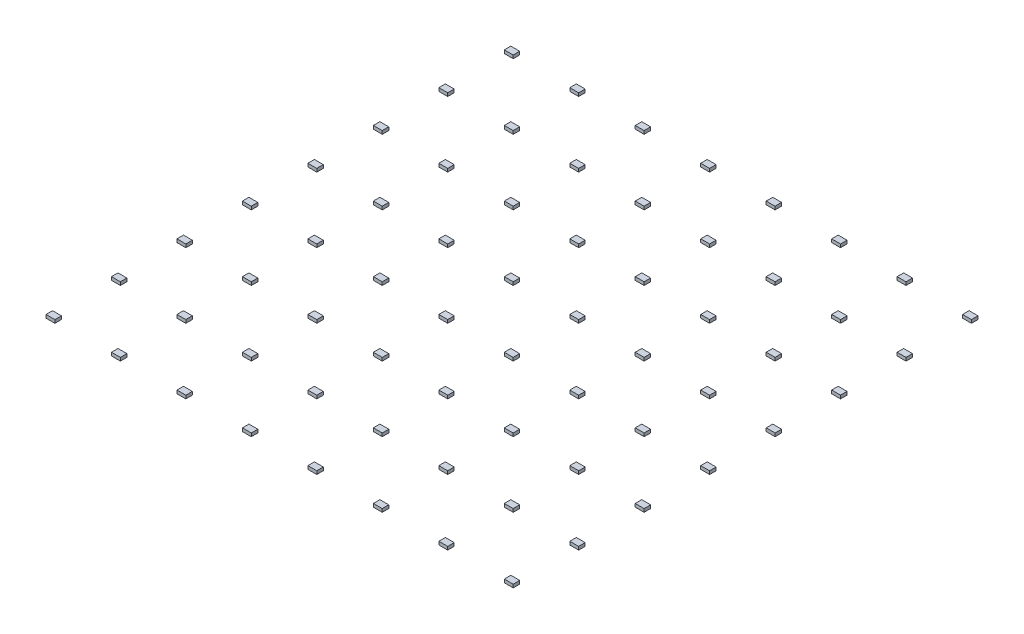
from build123d import *

# Parameters (mm, degrees)
SKETCH1_W                = 200
SKETCH1_H                = 200
BOSS_EXTRUDE1_DEPTH      = 3
SKETCH2_W                = 24.5625
SKETCH2_H                = 24.5625
CUT_EXTRUDE1_DEPTH       = 0.25
SKETCH4_W                = 4.4
SKETCH4_H                = 3.5
SKETCH4_W_2              = 3.9
SKETCH4_H_2              = 3
SKETCH4_W_3              = 1.95
SKETCH4_H_3              = 1.5
CUT_EXTRUDE2_DEPTH       = 1.5
SKETCH7_W                = 4.4
SKETCH7_H                = 3.5
SKETCH7_W_2              = 3.4
SKETCH7_H_2              = 2.5
CUT_EXTRUDE4_DEPTH       = 1.25
SKETCH8_W                = 219.159240905
SKETCH8_H                = 226.00633715
CUT_EXTRUDE5_DEPTH       = 1.5
CUT_EXTRUDE6_START       = -1.5
CUT_EXTRUDE6_OUTLINE_W   = 200
CUT_EXTRUDE6_OUTLINE_H   = 200
CUT_EXTRUDE6_OUTLINE_W_2 = 4.4
CUT_EXTRUDE6_OUTLINE_H_2 = 3.5
CUT_EXTRUDE6_DEPTH       = 1.5
CUT_EXTRUDE6_START_2     = -0.25
CUT_EXTRUDE6_2_OUTLINE_W = 4.4
CUT_EXTRUDE6_2_OUTLINE_H = 3.5
CUT_EXTRUDE6_2_DEPTH     = 0.25


with BuildPart() as part:
    # Sketch1 → Boss-Extrude1 (new body)
    with BuildSketch(Plane(origin=(0, 0, 0), x_dir=(1, 0, 0), z_dir=(0, 1, 0))):
        with Locations((100, 100)):
            Rectangle(SKETCH1_W, SKETCH1_H)
    extrude(amount=BOSS_EXTRUDE1_DEPTH)

    # Sketch2 → Cut-Extrude1 (cut)
    with BuildSketch(Plane(origin=(0, 3, 0), x_dir=(1, 0, 0), z_dir=(0, 1, 0))):
        Polygon((150.375, 24.5625), (174.9375, 24.5625), (174.9375, 0), (175.4375, 0), (175.4375, 24.5625), (200, 24.5625), (200, 25.0625), (175.4375, 25.0625), (175.4375, 49.625), (200, 49.625), (200, 50.125), (175.4375, 50.125), (175.4375, 74.6875), (200, 74.6875), (200, 75.1875), (175.4375, 75.1875), (175.4375, 99.75), (200, 99.75), (200, 100.25), (175.4375, 100.25), (175.4375, 124.8125), (200, 124.8125), (200, 125.3125), (175.4375, 125.3125), (175.4375, 149.875), (200, 149.875), (200, 150.375), (175.4375, 150.375), (175.4375, 174.9375), (200, 174.9375), (200, 175.4375), (175.4375, 175.4375), (175.4375, 200), (174.9375, 200), (174.9375, 175.4375), (150.375, 175.4375), (150.375, 200), (149.875, 200), (149.875, 175.4375), (125.3125, 175.4375), (125.3125, 200), (124.8125, 200), (124.8125, 175.4375), (100.25, 175.4375), (100.25, 200), (99.75, 200), (99.75, 175.4375), (75.1875, 175.4375), (75.1875, 200), (74.6875, 200), (74.6875, 175.4375), (50.125, 175.4375), (50.125, 200), (49.625, 200), (49.625, 175.4375), (25.0625, 175.4375), (25.0625, 200), (24.5625, 200), (24.5625, 175.4375), (0, 175.4375), (0, 174.9375), (24.5625, 174.9375), (24.5625, 150.375), (0, 150.375), (0, 149.875), (24.5625, 149.875), (24.5625, 125.3125), (0, 125.3125), (0, 124.8125), (24.5625, 124.8125), (24.5625, 100.25), (0, 100.25), (0, 99.75), (24.5625, 99.75), (24.5625, 75.1875), (0, 75.1875), (0, 74.6875), (24.5625, 74.6875), (24.5625, 50.125), (0, 50.125), (0, 49.625), (24.5625, 49.625), (24.5625, 25.0625), (0, 25.0625), (0, 24.5625), (24.5625, 24.5625), (24.5625, 0), (25.0625, 0), (25.0625, 24.5625), (49.625, 24.5625), (49.625, 0), (50.125, 0), (50.125, 24.5625), (74.6875, 24.5625), (74.6875, 0), (75.1875, 0), (75.1875, 24.5625), (99.75, 24.5625), (99.75, 0), (100.25, 0), (100.25, 24.5625), (124.8125, 24.5625), (124.8125, 0), (125.3125, 0), (125.3125, 24.5625), (149.875, 24.5625), (149.875, 0), (150.375, 0), align=None)
        with Locations((37.34375, 37.34375)):
            Rectangle(SKETCH2_W, SKETCH2_H, mode=Mode.SUBTRACT)
        with Locations((62.40625, 37.34375)):
            Rectangle(SKETCH2_W, SKETCH2_H, mode=Mode.SUBTRACT)
        with Locations((37.34375, 62.40625)):
            Rectangle(SKETCH2_W, SKETCH2_H, mode=Mode.SUBTRACT)
        with Locations((62.40625, 62.40625)):
            Rectangle(SKETCH2_W, SKETCH2_H, mode=Mode.SUBTRACT)
        with Locations((87.46875, 37.34375)):
            Rectangle(SKETCH2_W, SKETCH2_H, mode=Mode.SUBTRACT)
        with Locations((87.46875, 62.40625)):
            Rectangle(SKETCH2_W, SKETCH2_H, mode=Mode.SUBTRACT)
        with Locations((37.34375, 87.46875)):
            Rectangle(SKETCH2_W, SKETCH2_H, mode=Mode.SUBTRACT)
        with Locations((62.40625, 87.46875)):
            Rectangle(SKETCH2_W, SKETCH2_H, mode=Mode.SUBTRACT)
        with Locations((87.46875, 87.46875)):
            Rectangle(SKETCH2_W, SKETCH2_H, mode=Mode.SUBTRACT)
        with Locations((112.53125, 37.34375)):
            Rectangle(SKETCH2_W, SKETCH2_H, mode=Mode.SUBTRACT)
        with Locations((112.53125, 62.40625)):
            Rectangle(SKETCH2_W, SKETCH2_H, mode=Mode.SUBTRACT)
        with Locations((137.59375, 37.34375)):
            Rectangle(SKETCH2_W, SKETCH2_H, mode=Mode.SUBTRACT)
        with Locations((162.65625, 37.34375)):
            Rectangle(SKETCH2_W, SKETCH2_H, mode=Mode.SUBTRACT)
        with Locations((137.59375, 62.40625)):
            Rectangle(SKETCH2_W, SKETCH2_H, mode=Mode.SUBTRACT)
        with Locations((162.65625, 62.40625)):
            Rectangle(SKETCH2_W, SKETCH2_H, mode=Mode.SUBTRACT)
        with Locations((112.53125, 87.46875)):
            Rectangle(SKETCH2_W, SKETCH2_H, mode=Mode.SUBTRACT)
        with Locations((137.59375, 87.46875)):
            Rectangle(SKETCH2_W, SKETCH2_H, mode=Mode.SUBTRACT)
        with Locations((162.65625, 87.46875)):
            Rectangle(SKETCH2_W, SKETCH2_H, mode=Mode.SUBTRACT)
        with Locations((37.34375, 112.53125)):
            Rectangle(SKETCH2_W, SKETCH2_H, mode=Mode.SUBTRACT)
        with Locations((62.40625, 112.53125)):
            Rectangle(SKETCH2_W, SKETCH2_H, mode=Mode.SUBTRACT)
        with Locations((87.46875, 112.53125)):
            Rectangle(SKETCH2_W, SKETCH2_H, mode=Mode.SUBTRACT)
        with Locations((37.34375, 137.59375)):
            Rectangle(SKETCH2_W, SKETCH2_H, mode=Mode.SUBTRACT)
        with Locations((62.40625, 137.59375)):
            Rectangle(SKETCH2_W, SKETCH2_H, mode=Mode.SUBTRACT)
        with Locations((37.34375, 162.65625)):
            Rectangle(SKETCH2_W, SKETCH2_H, mode=Mode.SUBTRACT)
        with Locations((62.40625, 162.65625)):
            Rectangle(SKETCH2_W, SKETCH2_H, mode=Mode.SUBTRACT)
        with Locations((87.46875, 137.59375)):
            Rectangle(SKETCH2_W, SKETCH2_H, mode=Mode.SUBTRACT)
        with Locations((87.46875, 162.65625)):
            Rectangle(SKETCH2_W, SKETCH2_H, mode=Mode.SUBTRACT)
        with Locations((112.53125, 112.53125)):
            Rectangle(SKETCH2_W, SKETCH2_H, mode=Mode.SUBTRACT)
        with Locations((137.59375, 112.53125)):
            Rectangle(SKETCH2_W, SKETCH2_H, mode=Mode.SUBTRACT)
        with Locations((162.65625, 112.53125)):
            Rectangle(SKETCH2_W, SKETCH2_H, mode=Mode.SUBTRACT)
        with Locations((112.53125, 137.59375)):
            Rectangle(SKETCH2_W, SKETCH2_H, mode=Mode.SUBTRACT)
        with Locations((112.53125, 162.65625)):
            Rectangle(SKETCH2_W, SKETCH2_H, mode=Mode.SUBTRACT)
        with Locations((137.59375, 137.59375)):
            Rectangle(SKETCH2_W, SKETCH2_H, mode=Mode.SUBTRACT)
        with Locations((162.65625, 137.59375)):
            Rectangle(SKETCH2_W, SKETCH2_H, mode=Mode.SUBTRACT)
        with Locations((137.59375, 162.65625)):
            Rectangle(SKETCH2_W, SKETCH2_H, mode=Mode.SUBTRACT)
        with Locations((162.65625, 162.65625)):
            Rectangle(SKETCH2_W, SKETCH2_H, mode=Mode.SUBTRACT)
    extrude(amount=-CUT_EXTRUDE1_DEPTH, mode=Mode.SUBTRACT)

    # Sketch4 → Cut-Extrude2 (cut)
    # profile 1 of 68: a face of its own
    with BuildSketch(Plane.XZ):
        with Locations((37.3425, -162.6575)):
            Rectangle(SKETCH4_W, SKETCH4_H)
    # profile 2 of 68: a face of its own
    with BuildSketch(Plane.XZ):
        with Locations((12.28, -162.6575)):
            Rectangle(SKETCH4_W, SKETCH4_H)
    # profile 3 of 68: a face of its own
    with BuildSketch(Plane.XZ):
        with Locations((12.28, -187.72)):
            Rectangle(SKETCH4_W, SKETCH4_H)
        with Locations((12.28, -187.72)):
            Rectangle(SKETCH4_W_2, SKETCH4_H_2, mode=Mode.SUBTRACT)
    # profile 4 of 68: a face of its own
    with BuildSketch(Plane.XZ):
        with Locations((13.255, -188.47)):
            Rectangle(SKETCH4_W_3, SKETCH4_H_3)
    # profile 5 of 68: a face of its own
    with BuildSketch(Plane.XZ):
        with Locations((13.255, -186.97)):
            Rectangle(SKETCH4_W_3, SKETCH4_H_3)
    # profile 6 of 68: a face of its own
    with BuildSketch(Plane.XZ):
        with Locations((11.305, -186.97)):
            Rectangle(SKETCH4_W_3, SKETCH4_H_3)
    # profile 7 of 68: a face of its own
    with BuildSketch(Plane.XZ):
        with Locations((11.305, -188.47)):
            Rectangle(SKETCH4_W_3, SKETCH4_H_3)
    # profile 8 of 68: a face of its own
    with BuildSketch(Plane.XZ):
        with Locations((37.3425, -187.72)):
            Rectangle(SKETCH4_W, SKETCH4_H)
    # profile 9 of 68: a face of its own
    with BuildSketch(Plane.XZ):
        with Locations((62.405, -187.72)):
            Rectangle(SKETCH4_W, SKETCH4_H)
    # profile 10 of 68: a face of its own
    with BuildSketch(Plane.XZ):
        with Locations((87.4675, -187.72)):
            Rectangle(SKETCH4_W, SKETCH4_H)
    # profile 11 of 68: a face of its own
    with BuildSketch(Plane.XZ):
        with Locations((112.53, -187.72)):
            Rectangle(SKETCH4_W, SKETCH4_H)
    # profile 12 of 68: a face of its own
    with BuildSketch(Plane.XZ):
        with Locations((137.5925, -187.72)):
            Rectangle(SKETCH4_W, SKETCH4_H)
    # profile 13 of 68: a face of its own
    with BuildSketch(Plane.XZ):
        with Locations((162.655, -187.72)):
            Rectangle(SKETCH4_W, SKETCH4_H)
    # profile 14 of 68: a face of its own
    with BuildSketch(Plane.XZ):
        with Locations((187.7175, -187.72)):
            Rectangle(SKETCH4_W, SKETCH4_H)
    # profile 15 of 68: a face of its own
    with BuildSketch(Plane.XZ):
        with Locations((187.7175, -162.6575)):
            Rectangle(SKETCH4_W, SKETCH4_H)
    # profile 16 of 68: a face of its own
    with BuildSketch(Plane.XZ):
        with Locations((162.655, -162.6575)):
            Rectangle(SKETCH4_W, SKETCH4_H)
    # profile 17 of 68: a face of its own
    with BuildSketch(Plane.XZ):
        with Locations((137.5925, -162.6575)):
            Rectangle(SKETCH4_W, SKETCH4_H)
    # profile 18 of 68: a face of its own
    with BuildSketch(Plane.XZ):
        with Locations((112.53, -162.6575)):
            Rectangle(SKETCH4_W, SKETCH4_H)
    # profile 19 of 68: a face of its own
    with BuildSketch(Plane.XZ):
        with Locations((87.4675, -162.6575)):
            Rectangle(SKETCH4_W, SKETCH4_H)
    # profile 20 of 68: a face of its own
    with BuildSketch(Plane.XZ):
        with Locations((62.405, -162.6575)):
            Rectangle(SKETCH4_W, SKETCH4_H)
    # profile 21 of 68: a face of its own
    with BuildSketch(Plane.XZ):
        with Locations((12.28, -137.595)):
            Rectangle(SKETCH4_W, SKETCH4_H)
    # profile 22 of 68: a face of its own
    with BuildSketch(Plane.XZ):
        with Locations((37.3425, -137.595)):
            Rectangle(SKETCH4_W, SKETCH4_H)
    # profile 23 of 68: a face of its own
    with BuildSketch(Plane.XZ):
        with Locations((62.405, -137.595)):
            Rectangle(SKETCH4_W, SKETCH4_H)
    # profile 24 of 68: a face of its own
    with BuildSketch(Plane.XZ):
        with Locations((87.4675, -137.595)):
            Rectangle(SKETCH4_W, SKETCH4_H)
    # profile 25 of 68: a face of its own
    with BuildSketch(Plane.XZ):
        with Locations((112.53, -137.595)):
            Rectangle(SKETCH4_W, SKETCH4_H)
    # profile 26 of 68: a face of its own
    with BuildSketch(Plane.XZ):
        with Locations((137.5925, -137.595)):
            Rectangle(SKETCH4_W, SKETCH4_H)
    # profile 27 of 68: a face of its own
    with BuildSketch(Plane.XZ):
        with Locations((162.655, -137.595)):
            Rectangle(SKETCH4_W, SKETCH4_H)
    # profile 28 of 68: a face of its own
    with BuildSketch(Plane.XZ):
        with Locations((187.7175, -137.595)):
            Rectangle(SKETCH4_W, SKETCH4_H)
    # profile 29 of 68: a face of its own
    with BuildSketch(Plane.XZ):
        with Locations((187.7175, -112.5325)):
            Rectangle(SKETCH4_W, SKETCH4_H)
    # profile 30 of 68: a face of its own
    with BuildSketch(Plane.XZ):
        with Locations((162.655, -112.5325)):
            Rectangle(SKETCH4_W, SKETCH4_H)
    # profile 31 of 68: a face of its own
    with BuildSketch(Plane.XZ):
        with Locations((137.5925, -112.5325)):
            Rectangle(SKETCH4_W, SKETCH4_H)
    # profile 32 of 68: a face of its own
    with BuildSketch(Plane.XZ):
        with Locations((112.53, -112.5325)):
            Rectangle(SKETCH4_W, SKETCH4_H)
    # profile 33 of 68: a face of its own
    with BuildSketch(Plane.XZ):
        with Locations((87.4675, -112.5325)):
            Rectangle(SKETCH4_W, SKETCH4_H)
    # profile 34 of 68: a face of its own
    with BuildSketch(Plane.XZ):
        with Locations((62.405, -112.5325)):
            Rectangle(SKETCH4_W, SKETCH4_H)
    # profile 35 of 68: a face of its own
    with BuildSketch(Plane.XZ):
        with Locations((37.3425, -112.5325)):
            Rectangle(SKETCH4_W, SKETCH4_H)
    # profile 36 of 68: a face of its own
    with BuildSketch(Plane.XZ):
        with Locations((12.28, -112.5325)):
            Rectangle(SKETCH4_W, SKETCH4_H)
    # profile 37 of 68: a face of its own
    with BuildSketch(Plane.XZ):
        with Locations((12.28, -87.47)):
            Rectangle(SKETCH4_W, SKETCH4_H)
    # profile 38 of 68: a face of its own
    with BuildSketch(Plane.XZ):
        with Locations((37.3425, -87.47)):
            Rectangle(SKETCH4_W, SKETCH4_H)
    # profile 39 of 68: a face of its own
    with BuildSketch(Plane.XZ):
        with Locations((62.405, -87.47)):
            Rectangle(SKETCH4_W, SKETCH4_H)
    # profile 40 of 68: a face of its own
    with BuildSketch(Plane.XZ):
        with Locations((87.4675, -87.47)):
            Rectangle(SKETCH4_W, SKETCH4_H)
    # profile 41 of 68: a face of its own
    with BuildSketch(Plane.XZ):
        with Locations((112.53, -87.47)):
            Rectangle(SKETCH4_W, SKETCH4_H)
    # profile 42 of 68: a face of its own
    with BuildSketch(Plane.XZ):
        with Locations((137.5925, -87.47)):
            Rectangle(SKETCH4_W, SKETCH4_H)
    # profile 43 of 68: a face of its own
    with BuildSketch(Plane.XZ):
        with Locations((162.655, -87.47)):
            Rectangle(SKETCH4_W, SKETCH4_H)
    # profile 44 of 68: a face of its own
    with BuildSketch(Plane.XZ):
        with Locations((187.7175, -87.47)):
            Rectangle(SKETCH4_W, SKETCH4_H)
    # profile 45 of 68: a face of its own
    with BuildSketch(Plane.XZ):
        with Locations((187.7175, -62.4075)):
            Rectangle(SKETCH4_W, SKETCH4_H)
    # profile 46 of 68: a face of its own
    with BuildSketch(Plane.XZ):
        with Locations((162.655, -62.4075)):
            Rectangle(SKETCH4_W, SKETCH4_H)
    # profile 47 of 68: a face of its own
    with BuildSketch(Plane.XZ):
        with Locations((137.5925, -62.4075)):
            Rectangle(SKETCH4_W, SKETCH4_H)
    # profile 48 of 68: a face of its own
    with BuildSketch(Plane.XZ):
        with Locations((112.53, -62.4075)):
            Rectangle(SKETCH4_W, SKETCH4_H)
    # profile 49 of 68: a face of its own
    with BuildSketch(Plane.XZ):
        with Locations((87.4675, -62.4075)):
            Rectangle(SKETCH4_W, SKETCH4_H)
    # profile 50 of 68: a face of its own
    with BuildSketch(Plane.XZ):
        with Locations((62.405, -62.4075)):
            Rectangle(SKETCH4_W, SKETCH4_H)
    # profile 51 of 68: a face of its own
    with BuildSketch(Plane.XZ):
        with Locations((37.3425, -62.4075)):
            Rectangle(SKETCH4_W, SKETCH4_H)
    # profile 52 of 68: a face of its own
    with BuildSketch(Plane.XZ):
        with Locations((12.28, -62.4075)):
            Rectangle(SKETCH4_W, SKETCH4_H)
    # profile 53 of 68: a face of its own
    with BuildSketch(Plane.XZ):
        with Locations((12.28, -37.345)):
            Rectangle(SKETCH4_W, SKETCH4_H)
    # profile 54 of 68: a face of its own
    with BuildSketch(Plane.XZ):
        with Locations((37.3425, -37.345)):
            Rectangle(SKETCH4_W, SKETCH4_H)
    # profile 55 of 68: a face of its own
    with BuildSketch(Plane.XZ):
        with Locations((62.405, -37.345)):
            Rectangle(SKETCH4_W, SKETCH4_H)
    # profile 56 of 68: a face of its own
    with BuildSketch(Plane.XZ):
        with Locations((87.4675, -37.345)):
            Rectangle(SKETCH4_W, SKETCH4_H)
    # profile 57 of 68: a face of its own
    with BuildSketch(Plane.XZ):
        with Locations((112.53, -37.345)):
            Rectangle(SKETCH4_W, SKETCH4_H)
    # profile 58 of 68: a face of its own
    with BuildSketch(Plane.XZ):
        with Locations((137.5925, -37.345)):
            Rectangle(SKETCH4_W, SKETCH4_H)
    # profile 59 of 68: a face of its own
    with BuildSketch(Plane.XZ):
        with Locations((162.655, -37.345)):
            Rectangle(SKETCH4_W, SKETCH4_H)
    # profile 60 of 68: a face of its own
    with BuildSketch(Plane.XZ):
        with Locations((187.7175, -37.345)):
            Rectangle(SKETCH4_W, SKETCH4_H)
    # profile 61 of 68: a face of its own
    with BuildSketch(Plane.XZ):
        with Locations((187.7175, -12.2825)):
            Rectangle(SKETCH4_W, SKETCH4_H)
    # profile 62 of 68: a face of its own
    with BuildSketch(Plane.XZ):
        with Locations((162.655, -12.2825)):
            Rectangle(SKETCH4_W, SKETCH4_H)
    # profile 63 of 68: a face of its own
    with BuildSketch(Plane.XZ):
        with Locations((137.5925, -12.2825)):
            Rectangle(SKETCH4_W, SKETCH4_H)
    # profile 64 of 68: a face of its own
    with BuildSketch(Plane.XZ):
        with Locations((112.53, -12.2825)):
            Rectangle(SKETCH4_W, SKETCH4_H)
    # profile 65 of 68: a face of its own
    with BuildSketch(Plane.XZ):
        with Locations((87.4675, -12.2825)):
            Rectangle(SKETCH4_W, SKETCH4_H)
    # profile 66 of 68: a face of its own
    with BuildSketch(Plane.XZ):
        with Locations((62.405, -12.2825)):
            Rectangle(SKETCH4_W, SKETCH4_H)
    # profile 67 of 68: a face of its own
    with BuildSketch(Plane.XZ):
        with Locations((12.28, -12.2825)):
            Rectangle(SKETCH4_W, SKETCH4_H)
    # profile 68 of 68: a face of its own
    with BuildSketch(Plane.XZ):
        with Locations((37.3425, -12.2825)):
            Rectangle(SKETCH4_W, SKETCH4_H)
    extrude(amount=-CUT_EXTRUDE2_DEPTH, mode=Mode.SUBTRACT)

    # Sketch7 → Cut-Extrude4 (cut)
    # profile 1 of 64: a face of its own
    with BuildSketch(Plane.XZ.offset(-1.5)):
        with Locations((187.7175, -162.6575)):
            Rectangle(SKETCH7_W, SKETCH7_H)
        with Locations((187.7175, -162.6575)):
            Rectangle(SKETCH7_W_2, SKETCH7_H_2, mode=Mode.SUBTRACT)
    # profile 2 of 64: a face of its own
    with BuildSketch(Plane.XZ.offset(-1.5)):
        with Locations((187.7175, -187.72)):
            Rectangle(SKETCH7_W, SKETCH7_H)
        with Locations((187.7175, -187.72)):
            Rectangle(SKETCH7_W_2, SKETCH7_H_2, mode=Mode.SUBTRACT)
    # profile 3 of 64: a face of its own
    with BuildSketch(Plane.XZ.offset(-1.5)):
        with Locations((187.7175, -137.595)):
            Rectangle(SKETCH7_W, SKETCH7_H)
        with Locations((187.7175, -137.595)):
            Rectangle(SKETCH7_W_2, SKETCH7_H_2, mode=Mode.SUBTRACT)
    # profile 4 of 64: a face of its own
    with BuildSketch(Plane.XZ.offset(-1.5)):
        with Locations((187.7175, -112.5325)):
            Rectangle(SKETCH7_W, SKETCH7_H)
        with Locations((187.7175, -112.5325)):
            Rectangle(SKETCH7_W_2, SKETCH7_H_2, mode=Mode.SUBTRACT)
    # profile 5 of 64: a face of its own
    with BuildSketch(Plane.XZ.offset(-1.5)):
        with Locations((187.7175, -87.47)):
            Rectangle(SKETCH7_W, SKETCH7_H)
        with Locations((187.7175, -87.47)):
            Rectangle(SKETCH7_W_2, SKETCH7_H_2, mode=Mode.SUBTRACT)
    # profile 6 of 64: a face of its own
    with BuildSketch(Plane.XZ.offset(-1.5)):
        with Locations((187.7175, -62.4075)):
            Rectangle(SKETCH7_W, SKETCH7_H)
        with Locations((187.7175, -62.4075)):
            Rectangle(SKETCH7_W_2, SKETCH7_H_2, mode=Mode.SUBTRACT)
    # profile 7 of 64: a face of its own
    with BuildSketch(Plane.XZ.offset(-1.5)):
        with Locations((187.7175, -37.345)):
            Rectangle(SKETCH7_W, SKETCH7_H)
        with Locations((187.7175, -37.345)):
            Rectangle(SKETCH7_W_2, SKETCH7_H_2, mode=Mode.SUBTRACT)
    # profile 8 of 64: a face of its own
    with BuildSketch(Plane.XZ.offset(-1.5)):
        with Locations((187.7175, -12.2825)):
            Rectangle(SKETCH7_W, SKETCH7_H)
        with Locations((187.7175, -12.2825)):
            Rectangle(SKETCH7_W_2, SKETCH7_H_2, mode=Mode.SUBTRACT)
    # profile 9 of 64: a face of its own
    with BuildSketch(Plane.XZ.offset(-1.5)):
        with Locations((162.655, -162.6575)):
            Rectangle(SKETCH7_W, SKETCH7_H)
        with Locations((162.655, -162.6575)):
            Rectangle(SKETCH7_W_2, SKETCH7_H_2, mode=Mode.SUBTRACT)
    # profile 10 of 64: a face of its own
    with BuildSketch(Plane.XZ.offset(-1.5)):
        with Locations((162.655, -137.595)):
            Rectangle(SKETCH7_W, SKETCH7_H)
        with Locations((162.655, -137.595)):
            Rectangle(SKETCH7_W_2, SKETCH7_H_2, mode=Mode.SUBTRACT)
    # profile 11 of 64: a face of its own
    with BuildSketch(Plane.XZ.offset(-1.5)):
        with Locations((162.655, -112.5325)):
            Rectangle(SKETCH7_W, SKETCH7_H)
        with Locations((162.655, -112.5325)):
            Rectangle(SKETCH7_W_2, SKETCH7_H_2, mode=Mode.SUBTRACT)
    # profile 12 of 64: a face of its own
    with BuildSketch(Plane.XZ.offset(-1.5)):
        with Locations((162.655, -87.47)):
            Rectangle(SKETCH7_W, SKETCH7_H)
        with Locations((162.655, -87.47)):
            Rectangle(SKETCH7_W_2, SKETCH7_H_2, mode=Mode.SUBTRACT)
    # profile 13 of 64: a face of its own
    with BuildSketch(Plane.XZ.offset(-1.5)):
        with Locations((162.655, -62.4075)):
            Rectangle(SKETCH7_W, SKETCH7_H)
        with Locations((162.655, -62.4075)):
            Rectangle(SKETCH7_W_2, SKETCH7_H_2, mode=Mode.SUBTRACT)
    # profile 14 of 64: a face of its own
    with BuildSketch(Plane.XZ.offset(-1.5)):
        with Locations((162.655, -37.345)):
            Rectangle(SKETCH7_W, SKETCH7_H)
        with Locations((162.655, -37.345)):
            Rectangle(SKETCH7_W_2, SKETCH7_H_2, mode=Mode.SUBTRACT)
    # profile 15 of 64: a face of its own
    with BuildSketch(Plane.XZ.offset(-1.5)):
        with Locations((162.655, -12.2825)):
            Rectangle(SKETCH7_W, SKETCH7_H)
        with Locations((162.655, -12.2825)):
            Rectangle(SKETCH7_W_2, SKETCH7_H_2, mode=Mode.SUBTRACT)
    # profile 16 of 64: a face of its own
    with BuildSketch(Plane.XZ.offset(-1.5)):
        with Locations((137.5925, -162.6575)):
            Rectangle(SKETCH7_W, SKETCH7_H)
        with Locations((137.5925, -162.6575)):
            Rectangle(SKETCH7_W_2, SKETCH7_H_2, mode=Mode.SUBTRACT)
    # profile 17 of 64: a face of its own
    with BuildSketch(Plane.XZ.offset(-1.5)):
        with Locations((137.5925, -137.595)):
            Rectangle(SKETCH7_W, SKETCH7_H)
        with Locations((137.5925, -137.595)):
            Rectangle(SKETCH7_W_2, SKETCH7_H_2, mode=Mode.SUBTRACT)
    # profile 18 of 64: a face of its own
    with BuildSketch(Plane.XZ.offset(-1.5)):
        with Locations((137.5925, -112.5325)):
            Rectangle(SKETCH7_W, SKETCH7_H)
        with Locations((137.5925, -112.5325)):
            Rectangle(SKETCH7_W_2, SKETCH7_H_2, mode=Mode.SUBTRACT)
    # profile 19 of 64: a face of its own
    with BuildSketch(Plane.XZ.offset(-1.5)):
        with Locations((137.5925, -87.47)):
            Rectangle(SKETCH7_W, SKETCH7_H)
        with Locations((137.5925, -87.47)):
            Rectangle(SKETCH7_W_2, SKETCH7_H_2, mode=Mode.SUBTRACT)
    # profile 20 of 64: a face of its own
    with BuildSketch(Plane.XZ.offset(-1.5)):
        with Locations((137.5925, -62.4075)):
            Rectangle(SKETCH7_W, SKETCH7_H)
        with Locations((137.5925, -62.4075)):
            Rectangle(SKETCH7_W_2, SKETCH7_H_2, mode=Mode.SUBTRACT)
    # profile 21 of 64: a face of its own
    with BuildSketch(Plane.XZ.offset(-1.5)):
        with Locations((137.5925, -37.345)):
            Rectangle(SKETCH7_W, SKETCH7_H)
        with Locations((137.5925, -37.345)):
            Rectangle(SKETCH7_W_2, SKETCH7_H_2, mode=Mode.SUBTRACT)
    # profile 22 of 64: a face of its own
    with BuildSketch(Plane.XZ.offset(-1.5)):
        with Locations((137.5925, -12.2825)):
            Rectangle(SKETCH7_W, SKETCH7_H)
        with Locations((137.5925, -12.2825)):
            Rectangle(SKETCH7_W_2, SKETCH7_H_2, mode=Mode.SUBTRACT)
    # profile 23 of 64: a face of its own
    with BuildSketch(Plane.XZ.offset(-1.5)):
        with Locations((112.53, -162.6575)):
            Rectangle(SKETCH7_W, SKETCH7_H)
        with Locations((112.53, -162.6575)):
            Rectangle(SKETCH7_W_2, SKETCH7_H_2, mode=Mode.SUBTRACT)
    # profile 24 of 64: a face of its own
    with BuildSketch(Plane.XZ.offset(-1.5)):
        with Locations((112.53, -137.595)):
            Rectangle(SKETCH7_W, SKETCH7_H)
        with Locations((112.53, -137.595)):
            Rectangle(SKETCH7_W_2, SKETCH7_H_2, mode=Mode.SUBTRACT)
    # profile 25 of 64: a face of its own
    with BuildSketch(Plane.XZ.offset(-1.5)):
        with Locations((112.53, -112.5325)):
            Rectangle(SKETCH7_W, SKETCH7_H)
        with Locations((112.53, -112.5325)):
            Rectangle(SKETCH7_W_2, SKETCH7_H_2, mode=Mode.SUBTRACT)
    # profile 26 of 64: a face of its own
    with BuildSketch(Plane.XZ.offset(-1.5)):
        with Locations((112.53, -87.47)):
            Rectangle(SKETCH7_W, SKETCH7_H)
        with Locations((112.53, -87.47)):
            Rectangle(SKETCH7_W_2, SKETCH7_H_2, mode=Mode.SUBTRACT)
    # profile 27 of 64: a face of its own
    with BuildSketch(Plane.XZ.offset(-1.5)):
        with Locations((112.53, -62.4075)):
            Rectangle(SKETCH7_W, SKETCH7_H)
        with Locations((112.53, -62.4075)):
            Rectangle(SKETCH7_W_2, SKETCH7_H_2, mode=Mode.SUBTRACT)
    # profile 28 of 64: a face of its own
    with BuildSketch(Plane.XZ.offset(-1.5)):
        with Locations((112.53, -37.345)):
            Rectangle(SKETCH7_W, SKETCH7_H)
        with Locations((112.53, -37.345)):
            Rectangle(SKETCH7_W_2, SKETCH7_H_2, mode=Mode.SUBTRACT)
    # profile 29 of 64: a face of its own
    with BuildSketch(Plane.XZ.offset(-1.5)):
        with Locations((112.53, -12.2825)):
            Rectangle(SKETCH7_W, SKETCH7_H)
        with Locations((112.53, -12.2825)):
            Rectangle(SKETCH7_W_2, SKETCH7_H_2, mode=Mode.SUBTRACT)
    # profile 30 of 64: a face of its own
    with BuildSketch(Plane.XZ.offset(-1.5)):
        with Locations((87.4675, -162.6575)):
            Rectangle(SKETCH7_W, SKETCH7_H)
        with Locations((87.4675, -162.6575)):
            Rectangle(SKETCH7_W_2, SKETCH7_H_2, mode=Mode.SUBTRACT)
    # profile 31 of 64: a face of its own
    with BuildSketch(Plane.XZ.offset(-1.5)):
        with Locations((87.4675, -137.595)):
            Rectangle(SKETCH7_W, SKETCH7_H)
        with Locations((87.4675, -137.595)):
            Rectangle(SKETCH7_W_2, SKETCH7_H_2, mode=Mode.SUBTRACT)
    # profile 32 of 64: a face of its own
    with BuildSketch(Plane.XZ.offset(-1.5)):
        with Locations((87.4675, -112.5325)):
            Rectangle(SKETCH7_W, SKETCH7_H)
        with Locations((87.4675, -112.5325)):
            Rectangle(SKETCH7_W_2, SKETCH7_H_2, mode=Mode.SUBTRACT)
    # profile 33 of 64: a face of its own
    with BuildSketch(Plane.XZ.offset(-1.5)):
        with Locations((87.4675, -87.47)):
            Rectangle(SKETCH7_W, SKETCH7_H)
        with Locations((87.4675, -87.47)):
            Rectangle(SKETCH7_W_2, SKETCH7_H_2, mode=Mode.SUBTRACT)
    # profile 34 of 64: a face of its own
    with BuildSketch(Plane.XZ.offset(-1.5)):
        with Locations((87.4675, -62.4075)):
            Rectangle(SKETCH7_W, SKETCH7_H)
        with Locations((87.4675, -62.4075)):
            Rectangle(SKETCH7_W_2, SKETCH7_H_2, mode=Mode.SUBTRACT)
    # profile 35 of 64: a face of its own
    with BuildSketch(Plane.XZ.offset(-1.5)):
        with Locations((87.4675, -37.345)):
            Rectangle(SKETCH7_W, SKETCH7_H)
        with Locations((87.4675, -37.345)):
            Rectangle(SKETCH7_W_2, SKETCH7_H_2, mode=Mode.SUBTRACT)
    # profile 36 of 64: a face of its own
    with BuildSketch(Plane.XZ.offset(-1.5)):
        with Locations((87.4675, -12.2825)):
            Rectangle(SKETCH7_W, SKETCH7_H)
        with Locations((87.4675, -12.2825)):
            Rectangle(SKETCH7_W_2, SKETCH7_H_2, mode=Mode.SUBTRACT)
    # profile 37 of 64: a face of its own
    with BuildSketch(Plane.XZ.offset(-1.5)):
        with Locations((62.405, -162.6575)):
            Rectangle(SKETCH7_W, SKETCH7_H)
        with Locations((62.405, -162.6575)):
            Rectangle(SKETCH7_W_2, SKETCH7_H_2, mode=Mode.SUBTRACT)
    # profile 38 of 64: a face of its own
    with BuildSketch(Plane.XZ.offset(-1.5)):
        with Locations((62.405, -137.595)):
            Rectangle(SKETCH7_W, SKETCH7_H)
        with Locations((62.405, -137.595)):
            Rectangle(SKETCH7_W_2, SKETCH7_H_2, mode=Mode.SUBTRACT)
    # profile 39 of 64: a face of its own
    with BuildSketch(Plane.XZ.offset(-1.5)):
        with Locations((62.405, -112.5325)):
            Rectangle(SKETCH7_W, SKETCH7_H)
        with Locations((62.405, -112.5325)):
            Rectangle(SKETCH7_W_2, SKETCH7_H_2, mode=Mode.SUBTRACT)
    # profile 40 of 64: a face of its own
    with BuildSketch(Plane.XZ.offset(-1.5)):
        with Locations((62.405, -87.47)):
            Rectangle(SKETCH7_W, SKETCH7_H)
        with Locations((62.405, -87.47)):
            Rectangle(SKETCH7_W_2, SKETCH7_H_2, mode=Mode.SUBTRACT)
    # profile 41 of 64: a face of its own
    with BuildSketch(Plane.XZ.offset(-1.5)):
        with Locations((62.405, -62.4075)):
            Rectangle(SKETCH7_W, SKETCH7_H)
        with Locations((62.405, -62.4075)):
            Rectangle(SKETCH7_W_2, SKETCH7_H_2, mode=Mode.SUBTRACT)
    # profile 42 of 64: a face of its own
    with BuildSketch(Plane.XZ.offset(-1.5)):
        with Locations((62.405, -37.345)):
            Rectangle(SKETCH7_W, SKETCH7_H)
        with Locations((62.405, -37.345)):
            Rectangle(SKETCH7_W_2, SKETCH7_H_2, mode=Mode.SUBTRACT)
    # profile 43 of 64: a face of its own
    with BuildSketch(Plane.XZ.offset(-1.5)):
        with Locations((62.405, -12.2825)):
            Rectangle(SKETCH7_W, SKETCH7_H)
        with Locations((62.405, -12.2825)):
            Rectangle(SKETCH7_W_2, SKETCH7_H_2, mode=Mode.SUBTRACT)
    # profile 44 of 64: a face of its own
    with BuildSketch(Plane.XZ.offset(-1.5)):
        with Locations((37.3425, -162.6575)):
            Rectangle(SKETCH7_W, SKETCH7_H)
        with Locations((37.3425, -162.6575)):
            Rectangle(SKETCH7_W_2, SKETCH7_H_2, mode=Mode.SUBTRACT)
    # profile 45 of 64: a face of its own
    with BuildSketch(Plane.XZ.offset(-1.5)):
        with Locations((37.3425, -137.595)):
            Rectangle(SKETCH7_W, SKETCH7_H)
        with Locations((37.3425, -137.595)):
            Rectangle(SKETCH7_W_2, SKETCH7_H_2, mode=Mode.SUBTRACT)
    # profile 46 of 64: a face of its own
    with BuildSketch(Plane.XZ.offset(-1.5)):
        with Locations((37.3425, -112.5325)):
            Rectangle(SKETCH7_W, SKETCH7_H)
        with Locations((37.3425, -112.5325)):
            Rectangle(SKETCH7_W_2, SKETCH7_H_2, mode=Mode.SUBTRACT)
    # profile 47 of 64: a face of its own
    with BuildSketch(Plane.XZ.offset(-1.5)):
        with Locations((37.3425, -87.47)):
            Rectangle(SKETCH7_W, SKETCH7_H)
        with Locations((37.3425, -87.47)):
            Rectangle(SKETCH7_W_2, SKETCH7_H_2, mode=Mode.SUBTRACT)
    # profile 48 of 64: a face of its own
    with BuildSketch(Plane.XZ.offset(-1.5)):
        with Locations((37.3425, -62.4075)):
            Rectangle(SKETCH7_W, SKETCH7_H)
        with Locations((37.3425, -62.4075)):
            Rectangle(SKETCH7_W_2, SKETCH7_H_2, mode=Mode.SUBTRACT)
    # profile 49 of 64: a face of its own
    with BuildSketch(Plane.XZ.offset(-1.5)):
        with Locations((37.3425, -37.345)):
            Rectangle(SKETCH7_W, SKETCH7_H)
        with Locations((37.3425, -37.345)):
            Rectangle(SKETCH7_W_2, SKETCH7_H_2, mode=Mode.SUBTRACT)
    # profile 50 of 64: a face of its own
    with BuildSketch(Plane.XZ.offset(-1.5)):
        with Locations((37.3425, -12.2825)):
            Rectangle(SKETCH7_W, SKETCH7_H)
        with Locations((37.3425, -12.2825)):
            Rectangle(SKETCH7_W_2, SKETCH7_H_2, mode=Mode.SUBTRACT)
    # profile 51 of 64: a face of its own
    with BuildSketch(Plane.XZ.offset(-1.5)):
        with Locations((12.28, -162.6575)):
            Rectangle(SKETCH7_W, SKETCH7_H)
        with Locations((12.28, -162.6575)):
            Rectangle(SKETCH7_W_2, SKETCH7_H_2, mode=Mode.SUBTRACT)
    # profile 52 of 64: a face of its own
    with BuildSketch(Plane.XZ.offset(-1.5)):
        with Locations((12.28, -137.595)):
            Rectangle(SKETCH7_W, SKETCH7_H)
        with Locations((12.28, -137.595)):
            Rectangle(SKETCH7_W_2, SKETCH7_H_2, mode=Mode.SUBTRACT)
    # profile 53 of 64: a face of its own
    with BuildSketch(Plane.XZ.offset(-1.5)):
        with Locations((12.28, -112.5325)):
            Rectangle(SKETCH7_W, SKETCH7_H)
        with Locations((12.28, -112.5325)):
            Rectangle(SKETCH7_W_2, SKETCH7_H_2, mode=Mode.SUBTRACT)
    # profile 54 of 64: a face of its own
    with BuildSketch(Plane.XZ.offset(-1.5)):
        with Locations((12.28, -87.47)):
            Rectangle(SKETCH7_W, SKETCH7_H)
        with Locations((12.28, -87.47)):
            Rectangle(SKETCH7_W_2, SKETCH7_H_2, mode=Mode.SUBTRACT)
    # profile 55 of 64: a face of its own
    with BuildSketch(Plane.XZ.offset(-1.5)):
        with Locations((12.28, -62.4075)):
            Rectangle(SKETCH7_W, SKETCH7_H)
        with Locations((12.28, -62.4075)):
            Rectangle(SKETCH7_W_2, SKETCH7_H_2, mode=Mode.SUBTRACT)
    # profile 56 of 64: a face of its own
    with BuildSketch(Plane.XZ.offset(-1.5)):
        with Locations((12.28, -37.345)):
            Rectangle(SKETCH7_W, SKETCH7_H)
        with Locations((12.28, -37.345)):
            Rectangle(SKETCH7_W_2, SKETCH7_H_2, mode=Mode.SUBTRACT)
    # profile 57 of 64: a face of its own
    with BuildSketch(Plane.XZ.offset(-1.5)):
        with Locations((12.28, -12.2825)):
            Rectangle(SKETCH7_W, SKETCH7_H)
        with Locations((12.28, -12.2825)):
            Rectangle(SKETCH7_W_2, SKETCH7_H_2, mode=Mode.SUBTRACT)
    # profile 58 of 64: a face of its own
    with BuildSketch(Plane.XZ.offset(-1.5)):
        with Locations((162.655, -187.72)):
            Rectangle(SKETCH7_W, SKETCH7_H)
        with Locations((162.655, -187.72)):
            Rectangle(SKETCH7_W_2, SKETCH7_H_2, mode=Mode.SUBTRACT)
    # profile 59 of 64: a face of its own
    with BuildSketch(Plane.XZ.offset(-1.5)):
        with Locations((137.5925, -187.72)):
            Rectangle(SKETCH7_W, SKETCH7_H)
        with Locations((137.5925, -187.72)):
            Rectangle(SKETCH7_W_2, SKETCH7_H_2, mode=Mode.SUBTRACT)
    # profile 60 of 64: a face of its own
    with BuildSketch(Plane.XZ.offset(-1.5)):
        with Locations((112.53, -187.72)):
            Rectangle(SKETCH7_W, SKETCH7_H)
        with Locations((112.53, -187.72)):
            Rectangle(SKETCH7_W_2, SKETCH7_H_2, mode=Mode.SUBTRACT)
    # profile 61 of 64: a face of its own
    with BuildSketch(Plane.XZ.offset(-1.5)):
        with Locations((87.4675, -187.72)):
            Rectangle(SKETCH7_W, SKETCH7_H)
        with Locations((87.4675, -187.72)):
            Rectangle(SKETCH7_W_2, SKETCH7_H_2, mode=Mode.SUBTRACT)
    # profile 62 of 64: a face of its own
    with BuildSketch(Plane.XZ.offset(-1.5)):
        with Locations((62.405, -187.72)):
            Rectangle(SKETCH7_W, SKETCH7_H)
        with Locations((62.405, -187.72)):
            Rectangle(SKETCH7_W_2, SKETCH7_H_2, mode=Mode.SUBTRACT)
    # profile 63 of 64: a face of its own
    with BuildSketch(Plane.XZ.offset(-1.5)):
        with Locations((37.3425, -187.72)):
            Rectangle(SKETCH7_W, SKETCH7_H)
        with Locations((37.3425, -187.72)):
            Rectangle(SKETCH7_W_2, SKETCH7_H_2, mode=Mode.SUBTRACT)
    # profile 64 of 64: a face of its own
    with BuildSketch(Plane.XZ.offset(-1.5)):
        with Locations((12.28, -187.72)):
            Rectangle(SKETCH7_W, SKETCH7_H)
        with Locations((12.28, -187.72)):
            Rectangle(SKETCH7_W_2, SKETCH7_H_2, mode=Mode.SUBTRACT)
    extrude(amount=-CUT_EXTRUDE4_DEPTH, mode=Mode.SUBTRACT)

    # Sketch8 → Cut-Extrude5 (cut)
    with BuildSketch(Plane.XZ):
        with Locations((98.07486643, -102.189139227)):
            Rectangle(SKETCH8_W, SKETCH8_H)
    extrude(amount=-CUT_EXTRUDE5_DEPTH, mode=Mode.SUBTRACT)

    # Cut-Extrude6: read off the stored shape, not the designer's step
    # Cut-Extrude6 outline → Cut-Extrude6 (cut)
    with BuildSketch(Plane(origin=(0, 3, 0), x_dir=(1, 0, 0), z_dir=(0, 1, 0)).offset(CUT_EXTRUDE6_START)):
        with Locations((100, 100)):
            Rectangle(CUT_EXTRUDE6_OUTLINE_W, CUT_EXTRUDE6_OUTLINE_H)
        with Locations((12.28, 12.2825)):
            Rectangle(CUT_EXTRUDE6_OUTLINE_W_2, CUT_EXTRUDE6_OUTLINE_H_2, mode=Mode.SUBTRACT)
        with Locations((12.28, 37.345)):
            Rectangle(CUT_EXTRUDE6_OUTLINE_W_2, CUT_EXTRUDE6_OUTLINE_H_2, mode=Mode.SUBTRACT)
        with Locations((12.28, 62.4075)):
            Rectangle(CUT_EXTRUDE6_OUTLINE_W_2, CUT_EXTRUDE6_OUTLINE_H_2, mode=Mode.SUBTRACT)
        with Locations((12.28, 87.47)):
            Rectangle(CUT_EXTRUDE6_OUTLINE_W_2, CUT_EXTRUDE6_OUTLINE_H_2, mode=Mode.SUBTRACT)
        with Locations((12.28, 112.5325)):
            Rectangle(CUT_EXTRUDE6_OUTLINE_W_2, CUT_EXTRUDE6_OUTLINE_H_2, mode=Mode.SUBTRACT)
        with Locations((12.28, 137.595)):
            Rectangle(CUT_EXTRUDE6_OUTLINE_W_2, CUT_EXTRUDE6_OUTLINE_H_2, mode=Mode.SUBTRACT)
        with Locations((12.28, 162.6575)):
            Rectangle(CUT_EXTRUDE6_OUTLINE_W_2, CUT_EXTRUDE6_OUTLINE_H_2, mode=Mode.SUBTRACT)
        with Locations((12.28, 187.72)):
            Rectangle(CUT_EXTRUDE6_OUTLINE_W_2, CUT_EXTRUDE6_OUTLINE_H_2, mode=Mode.SUBTRACT)
        with Locations((37.3425, 187.72)):
            Rectangle(CUT_EXTRUDE6_OUTLINE_W_2, CUT_EXTRUDE6_OUTLINE_H_2, mode=Mode.SUBTRACT)
        with Locations((62.405, 187.72)):
            Rectangle(CUT_EXTRUDE6_OUTLINE_W_2, CUT_EXTRUDE6_OUTLINE_H_2, mode=Mode.SUBTRACT)
        with Locations((87.4675, 187.72)):
            Rectangle(CUT_EXTRUDE6_OUTLINE_W_2, CUT_EXTRUDE6_OUTLINE_H_2, mode=Mode.SUBTRACT)
        with Locations((112.53, 187.72)):
            Rectangle(CUT_EXTRUDE6_OUTLINE_W_2, CUT_EXTRUDE6_OUTLINE_H_2, mode=Mode.SUBTRACT)
        with Locations((137.5925, 187.72)):
            Rectangle(CUT_EXTRUDE6_OUTLINE_W_2, CUT_EXTRUDE6_OUTLINE_H_2, mode=Mode.SUBTRACT)
        with Locations((162.655, 187.72)):
            Rectangle(CUT_EXTRUDE6_OUTLINE_W_2, CUT_EXTRUDE6_OUTLINE_H_2, mode=Mode.SUBTRACT)
        with Locations((187.7175, 187.72)):
            Rectangle(CUT_EXTRUDE6_OUTLINE_W_2, CUT_EXTRUDE6_OUTLINE_H_2, mode=Mode.SUBTRACT)
        with Locations((187.7175, 162.6575)):
            Rectangle(CUT_EXTRUDE6_OUTLINE_W_2, CUT_EXTRUDE6_OUTLINE_H_2, mode=Mode.SUBTRACT)
        with Locations((187.7175, 137.595)):
            Rectangle(CUT_EXTRUDE6_OUTLINE_W_2, CUT_EXTRUDE6_OUTLINE_H_2, mode=Mode.SUBTRACT)
        with Locations((187.7175, 112.5325)):
            Rectangle(CUT_EXTRUDE6_OUTLINE_W_2, CUT_EXTRUDE6_OUTLINE_H_2, mode=Mode.SUBTRACT)
        with Locations((187.7175, 87.47)):
            Rectangle(CUT_EXTRUDE6_OUTLINE_W_2, CUT_EXTRUDE6_OUTLINE_H_2, mode=Mode.SUBTRACT)
        with Locations((187.7175, 62.4075)):
            Rectangle(CUT_EXTRUDE6_OUTLINE_W_2, CUT_EXTRUDE6_OUTLINE_H_2, mode=Mode.SUBTRACT)
        with Locations((187.7175, 37.345)):
            Rectangle(CUT_EXTRUDE6_OUTLINE_W_2, CUT_EXTRUDE6_OUTLINE_H_2, mode=Mode.SUBTRACT)
        with Locations((187.7175, 12.2825)):
            Rectangle(CUT_EXTRUDE6_OUTLINE_W_2, CUT_EXTRUDE6_OUTLINE_H_2, mode=Mode.SUBTRACT)
        with Locations((162.655, 12.2825)):
            Rectangle(CUT_EXTRUDE6_OUTLINE_W_2, CUT_EXTRUDE6_OUTLINE_H_2, mode=Mode.SUBTRACT)
        with Locations((137.5925, 12.2825)):
            Rectangle(CUT_EXTRUDE6_OUTLINE_W_2, CUT_EXTRUDE6_OUTLINE_H_2, mode=Mode.SUBTRACT)
        with Locations((112.53, 12.2825)):
            Rectangle(CUT_EXTRUDE6_OUTLINE_W_2, CUT_EXTRUDE6_OUTLINE_H_2, mode=Mode.SUBTRACT)
        with Locations((87.4675, 12.2825)):
            Rectangle(CUT_EXTRUDE6_OUTLINE_W_2, CUT_EXTRUDE6_OUTLINE_H_2, mode=Mode.SUBTRACT)
        with Locations((62.405, 12.2825)):
            Rectangle(CUT_EXTRUDE6_OUTLINE_W_2, CUT_EXTRUDE6_OUTLINE_H_2, mode=Mode.SUBTRACT)
        with Locations((37.3425, 12.2825)):
            Rectangle(CUT_EXTRUDE6_OUTLINE_W_2, CUT_EXTRUDE6_OUTLINE_H_2, mode=Mode.SUBTRACT)
        with Locations((162.655, 162.6575)):
            Rectangle(CUT_EXTRUDE6_OUTLINE_W_2, CUT_EXTRUDE6_OUTLINE_H_2, mode=Mode.SUBTRACT)
        with Locations((37.3425, 37.345)):
            Rectangle(CUT_EXTRUDE6_OUTLINE_W_2, CUT_EXTRUDE6_OUTLINE_H_2, mode=Mode.SUBTRACT)
        with Locations((62.405, 37.345)):
            Rectangle(CUT_EXTRUDE6_OUTLINE_W_2, CUT_EXTRUDE6_OUTLINE_H_2, mode=Mode.SUBTRACT)
        with Locations((87.4675, 37.345)):
            Rectangle(CUT_EXTRUDE6_OUTLINE_W_2, CUT_EXTRUDE6_OUTLINE_H_2, mode=Mode.SUBTRACT)
        with Locations((37.3425, 62.4075)):
            Rectangle(CUT_EXTRUDE6_OUTLINE_W_2, CUT_EXTRUDE6_OUTLINE_H_2, mode=Mode.SUBTRACT)
        with Locations((37.3425, 87.47)):
            Rectangle(CUT_EXTRUDE6_OUTLINE_W_2, CUT_EXTRUDE6_OUTLINE_H_2, mode=Mode.SUBTRACT)
        with Locations((62.405, 62.4075)):
            Rectangle(CUT_EXTRUDE6_OUTLINE_W_2, CUT_EXTRUDE6_OUTLINE_H_2, mode=Mode.SUBTRACT)
        with Locations((87.4675, 62.4075)):
            Rectangle(CUT_EXTRUDE6_OUTLINE_W_2, CUT_EXTRUDE6_OUTLINE_H_2, mode=Mode.SUBTRACT)
        with Locations((62.405, 87.47)):
            Rectangle(CUT_EXTRUDE6_OUTLINE_W_2, CUT_EXTRUDE6_OUTLINE_H_2, mode=Mode.SUBTRACT)
        with Locations((87.4675, 87.47)):
            Rectangle(CUT_EXTRUDE6_OUTLINE_W_2, CUT_EXTRUDE6_OUTLINE_H_2, mode=Mode.SUBTRACT)
        with Locations((112.53, 37.345)):
            Rectangle(CUT_EXTRUDE6_OUTLINE_W_2, CUT_EXTRUDE6_OUTLINE_H_2, mode=Mode.SUBTRACT)
        with Locations((137.5925, 37.345)):
            Rectangle(CUT_EXTRUDE6_OUTLINE_W_2, CUT_EXTRUDE6_OUTLINE_H_2, mode=Mode.SUBTRACT)
        with Locations((162.655, 37.345)):
            Rectangle(CUT_EXTRUDE6_OUTLINE_W_2, CUT_EXTRUDE6_OUTLINE_H_2, mode=Mode.SUBTRACT)
        with Locations((112.53, 62.4075)):
            Rectangle(CUT_EXTRUDE6_OUTLINE_W_2, CUT_EXTRUDE6_OUTLINE_H_2, mode=Mode.SUBTRACT)
        with Locations((137.5925, 62.4075)):
            Rectangle(CUT_EXTRUDE6_OUTLINE_W_2, CUT_EXTRUDE6_OUTLINE_H_2, mode=Mode.SUBTRACT)
        with Locations((112.53, 87.47)):
            Rectangle(CUT_EXTRUDE6_OUTLINE_W_2, CUT_EXTRUDE6_OUTLINE_H_2, mode=Mode.SUBTRACT)
        with Locations((137.5925, 87.47)):
            Rectangle(CUT_EXTRUDE6_OUTLINE_W_2, CUT_EXTRUDE6_OUTLINE_H_2, mode=Mode.SUBTRACT)
        with Locations((162.655, 62.4075)):
            Rectangle(CUT_EXTRUDE6_OUTLINE_W_2, CUT_EXTRUDE6_OUTLINE_H_2, mode=Mode.SUBTRACT)
        with Locations((162.655, 87.47)):
            Rectangle(CUT_EXTRUDE6_OUTLINE_W_2, CUT_EXTRUDE6_OUTLINE_H_2, mode=Mode.SUBTRACT)
        with Locations((37.3425, 112.5325)):
            Rectangle(CUT_EXTRUDE6_OUTLINE_W_2, CUT_EXTRUDE6_OUTLINE_H_2, mode=Mode.SUBTRACT)
        with Locations((37.3425, 137.595)):
            Rectangle(CUT_EXTRUDE6_OUTLINE_W_2, CUT_EXTRUDE6_OUTLINE_H_2, mode=Mode.SUBTRACT)
        with Locations((62.405, 112.5325)):
            Rectangle(CUT_EXTRUDE6_OUTLINE_W_2, CUT_EXTRUDE6_OUTLINE_H_2, mode=Mode.SUBTRACT)
        with Locations((87.4675, 112.5325)):
            Rectangle(CUT_EXTRUDE6_OUTLINE_W_2, CUT_EXTRUDE6_OUTLINE_H_2, mode=Mode.SUBTRACT)
        with Locations((62.405, 137.595)):
            Rectangle(CUT_EXTRUDE6_OUTLINE_W_2, CUT_EXTRUDE6_OUTLINE_H_2, mode=Mode.SUBTRACT)
        with Locations((87.4675, 137.595)):
            Rectangle(CUT_EXTRUDE6_OUTLINE_W_2, CUT_EXTRUDE6_OUTLINE_H_2, mode=Mode.SUBTRACT)
        with Locations((37.3425, 162.6575)):
            Rectangle(CUT_EXTRUDE6_OUTLINE_W_2, CUT_EXTRUDE6_OUTLINE_H_2, mode=Mode.SUBTRACT)
        with Locations((62.405, 162.6575)):
            Rectangle(CUT_EXTRUDE6_OUTLINE_W_2, CUT_EXTRUDE6_OUTLINE_H_2, mode=Mode.SUBTRACT)
        with Locations((87.4675, 162.6575)):
            Rectangle(CUT_EXTRUDE6_OUTLINE_W_2, CUT_EXTRUDE6_OUTLINE_H_2, mode=Mode.SUBTRACT)
        with Locations((112.53, 112.5325)):
            Rectangle(CUT_EXTRUDE6_OUTLINE_W_2, CUT_EXTRUDE6_OUTLINE_H_2, mode=Mode.SUBTRACT)
        with Locations((137.5925, 112.5325)):
            Rectangle(CUT_EXTRUDE6_OUTLINE_W_2, CUT_EXTRUDE6_OUTLINE_H_2, mode=Mode.SUBTRACT)
        with Locations((112.53, 137.595)):
            Rectangle(CUT_EXTRUDE6_OUTLINE_W_2, CUT_EXTRUDE6_OUTLINE_H_2, mode=Mode.SUBTRACT)
        with Locations((137.5925, 137.595)):
            Rectangle(CUT_EXTRUDE6_OUTLINE_W_2, CUT_EXTRUDE6_OUTLINE_H_2, mode=Mode.SUBTRACT)
        with Locations((162.655, 112.5325)):
            Rectangle(CUT_EXTRUDE6_OUTLINE_W_2, CUT_EXTRUDE6_OUTLINE_H_2, mode=Mode.SUBTRACT)
        with Locations((162.655, 137.595)):
            Rectangle(CUT_EXTRUDE6_OUTLINE_W_2, CUT_EXTRUDE6_OUTLINE_H_2, mode=Mode.SUBTRACT)
        with Locations((112.53, 162.6575)):
            Rectangle(CUT_EXTRUDE6_OUTLINE_W_2, CUT_EXTRUDE6_OUTLINE_H_2, mode=Mode.SUBTRACT)
        with Locations((137.5925, 162.6575)):
            Rectangle(CUT_EXTRUDE6_OUTLINE_W_2, CUT_EXTRUDE6_OUTLINE_H_2, mode=Mode.SUBTRACT)
    extrude(amount=CUT_EXTRUDE6_DEPTH, mode=Mode.SUBTRACT)

    # Cut-Extrude6 2 outline → Cut-Extrude6 2 (cut)
    with BuildSketch(Plane(origin=(0, 3, 0), x_dir=(1, 0, 0), z_dir=(0, 1, 0)).offset(CUT_EXTRUDE6_START_2)):
        with Locations((62.405, 137.595)):
            Rectangle(CUT_EXTRUDE6_2_OUTLINE_W, CUT_EXTRUDE6_2_OUTLINE_H)
        with Locations((87.4675, 137.595)):
            Rectangle(CUT_EXTRUDE6_2_OUTLINE_W, CUT_EXTRUDE6_2_OUTLINE_H)
        with Locations((112.53, 137.595)):
            Rectangle(CUT_EXTRUDE6_2_OUTLINE_W, CUT_EXTRUDE6_2_OUTLINE_H)
        with Locations((137.5925, 137.595)):
            Rectangle(CUT_EXTRUDE6_2_OUTLINE_W, CUT_EXTRUDE6_2_OUTLINE_H)
        with Locations((162.655, 137.595)):
            Rectangle(CUT_EXTRUDE6_2_OUTLINE_W, CUT_EXTRUDE6_2_OUTLINE_H)
        with Locations((187.7175, 137.595)):
            Rectangle(CUT_EXTRUDE6_2_OUTLINE_W, CUT_EXTRUDE6_2_OUTLINE_H)
        with Locations((12.28, 137.595)):
            Rectangle(CUT_EXTRUDE6_2_OUTLINE_W, CUT_EXTRUDE6_2_OUTLINE_H)
        with Locations((37.3425, 137.595)):
            Rectangle(CUT_EXTRUDE6_2_OUTLINE_W, CUT_EXTRUDE6_2_OUTLINE_H)
        with Locations((62.405, 112.5325)):
            Rectangle(CUT_EXTRUDE6_2_OUTLINE_W, CUT_EXTRUDE6_2_OUTLINE_H)
        with Locations((62.405, 187.72)):
            Rectangle(CUT_EXTRUDE6_2_OUTLINE_W, CUT_EXTRUDE6_2_OUTLINE_H)
        with Locations((62.405, 162.6575)):
            Rectangle(CUT_EXTRUDE6_2_OUTLINE_W, CUT_EXTRUDE6_2_OUTLINE_H)
        with Locations((62.405, 37.345)):
            Rectangle(CUT_EXTRUDE6_2_OUTLINE_W, CUT_EXTRUDE6_2_OUTLINE_H)
        with Locations((62.405, 12.2825)):
            Rectangle(CUT_EXTRUDE6_2_OUTLINE_W, CUT_EXTRUDE6_2_OUTLINE_H)
        with Locations((62.405, 87.47)):
            Rectangle(CUT_EXTRUDE6_2_OUTLINE_W, CUT_EXTRUDE6_2_OUTLINE_H)
        with Locations((62.405, 62.4075)):
            Rectangle(CUT_EXTRUDE6_2_OUTLINE_W, CUT_EXTRUDE6_2_OUTLINE_H)
        with Locations((87.4675, 112.5325)):
            Rectangle(CUT_EXTRUDE6_2_OUTLINE_W, CUT_EXTRUDE6_2_OUTLINE_H)
        with Locations((87.4675, 187.72)):
            Rectangle(CUT_EXTRUDE6_2_OUTLINE_W, CUT_EXTRUDE6_2_OUTLINE_H)
        with Locations((87.4675, 162.6575)):
            Rectangle(CUT_EXTRUDE6_2_OUTLINE_W, CUT_EXTRUDE6_2_OUTLINE_H)
        with Locations((87.4675, 37.345)):
            Rectangle(CUT_EXTRUDE6_2_OUTLINE_W, CUT_EXTRUDE6_2_OUTLINE_H)
        with Locations((87.4675, 12.2825)):
            Rectangle(CUT_EXTRUDE6_2_OUTLINE_W, CUT_EXTRUDE6_2_OUTLINE_H)
        with Locations((87.4675, 87.47)):
            Rectangle(CUT_EXTRUDE6_2_OUTLINE_W, CUT_EXTRUDE6_2_OUTLINE_H)
        with Locations((87.4675, 62.4075)):
            Rectangle(CUT_EXTRUDE6_2_OUTLINE_W, CUT_EXTRUDE6_2_OUTLINE_H)
        with Locations((112.53, 112.5325)):
            Rectangle(CUT_EXTRUDE6_2_OUTLINE_W, CUT_EXTRUDE6_2_OUTLINE_H)
        with Locations((112.53, 187.72)):
            Rectangle(CUT_EXTRUDE6_2_OUTLINE_W, CUT_EXTRUDE6_2_OUTLINE_H)
        with Locations((112.53, 162.6575)):
            Rectangle(CUT_EXTRUDE6_2_OUTLINE_W, CUT_EXTRUDE6_2_OUTLINE_H)
        with Locations((112.53, 37.345)):
            Rectangle(CUT_EXTRUDE6_2_OUTLINE_W, CUT_EXTRUDE6_2_OUTLINE_H)
        with Locations((112.53, 12.2825)):
            Rectangle(CUT_EXTRUDE6_2_OUTLINE_W, CUT_EXTRUDE6_2_OUTLINE_H)
        with Locations((112.53, 87.47)):
            Rectangle(CUT_EXTRUDE6_2_OUTLINE_W, CUT_EXTRUDE6_2_OUTLINE_H)
        with Locations((112.53, 62.4075)):
            Rectangle(CUT_EXTRUDE6_2_OUTLINE_W, CUT_EXTRUDE6_2_OUTLINE_H)
        with Locations((137.5925, 112.5325)):
            Rectangle(CUT_EXTRUDE6_2_OUTLINE_W, CUT_EXTRUDE6_2_OUTLINE_H)
        with Locations((137.5925, 187.72)):
            Rectangle(CUT_EXTRUDE6_2_OUTLINE_W, CUT_EXTRUDE6_2_OUTLINE_H)
        with Locations((137.5925, 162.6575)):
            Rectangle(CUT_EXTRUDE6_2_OUTLINE_W, CUT_EXTRUDE6_2_OUTLINE_H)
        with Locations((137.5925, 37.345)):
            Rectangle(CUT_EXTRUDE6_2_OUTLINE_W, CUT_EXTRUDE6_2_OUTLINE_H)
        with Locations((137.5925, 12.2825)):
            Rectangle(CUT_EXTRUDE6_2_OUTLINE_W, CUT_EXTRUDE6_2_OUTLINE_H)
        with Locations((137.5925, 87.47)):
            Rectangle(CUT_EXTRUDE6_2_OUTLINE_W, CUT_EXTRUDE6_2_OUTLINE_H)
        with Locations((137.5925, 62.4075)):
            Rectangle(CUT_EXTRUDE6_2_OUTLINE_W, CUT_EXTRUDE6_2_OUTLINE_H)
        with Locations((162.655, 112.5325)):
            Rectangle(CUT_EXTRUDE6_2_OUTLINE_W, CUT_EXTRUDE6_2_OUTLINE_H)
        with Locations((162.655, 187.72)):
            Rectangle(CUT_EXTRUDE6_2_OUTLINE_W, CUT_EXTRUDE6_2_OUTLINE_H)
        with Locations((162.655, 162.6575)):
            Rectangle(CUT_EXTRUDE6_2_OUTLINE_W, CUT_EXTRUDE6_2_OUTLINE_H)
        with Locations((162.655, 37.345)):
            Rectangle(CUT_EXTRUDE6_2_OUTLINE_W, CUT_EXTRUDE6_2_OUTLINE_H)
        with Locations((162.655, 12.2825)):
            Rectangle(CUT_EXTRUDE6_2_OUTLINE_W, CUT_EXTRUDE6_2_OUTLINE_H)
        with Locations((162.655, 87.47)):
            Rectangle(CUT_EXTRUDE6_2_OUTLINE_W, CUT_EXTRUDE6_2_OUTLINE_H)
        with Locations((162.655, 62.4075)):
            Rectangle(CUT_EXTRUDE6_2_OUTLINE_W, CUT_EXTRUDE6_2_OUTLINE_H)
        with Locations((187.7175, 112.5325)):
            Rectangle(CUT_EXTRUDE6_2_OUTLINE_W, CUT_EXTRUDE6_2_OUTLINE_H)
        with Locations((187.7175, 187.72)):
            Rectangle(CUT_EXTRUDE6_2_OUTLINE_W, CUT_EXTRUDE6_2_OUTLINE_H)
        with Locations((187.7175, 162.6575)):
            Rectangle(CUT_EXTRUDE6_2_OUTLINE_W, CUT_EXTRUDE6_2_OUTLINE_H)
        with Locations((187.7175, 37.345)):
            Rectangle(CUT_EXTRUDE6_2_OUTLINE_W, CUT_EXTRUDE6_2_OUTLINE_H)
        with Locations((187.7175, 12.2825)):
            Rectangle(CUT_EXTRUDE6_2_OUTLINE_W, CUT_EXTRUDE6_2_OUTLINE_H)
        with Locations((187.7175, 87.47)):
            Rectangle(CUT_EXTRUDE6_2_OUTLINE_W, CUT_EXTRUDE6_2_OUTLINE_H)
        with Locations((187.7175, 62.4075)):
            Rectangle(CUT_EXTRUDE6_2_OUTLINE_W, CUT_EXTRUDE6_2_OUTLINE_H)
        with Locations((37.3425, 112.5325)):
            Rectangle(CUT_EXTRUDE6_2_OUTLINE_W, CUT_EXTRUDE6_2_OUTLINE_H)
        with Locations((12.28, 112.5325)):
            Rectangle(CUT_EXTRUDE6_2_OUTLINE_W, CUT_EXTRUDE6_2_OUTLINE_H)
        with Locations((37.3425, 187.72)):
            Rectangle(CUT_EXTRUDE6_2_OUTLINE_W, CUT_EXTRUDE6_2_OUTLINE_H)
        with Locations((37.3425, 37.345)):
            Rectangle(CUT_EXTRUDE6_2_OUTLINE_W, CUT_EXTRUDE6_2_OUTLINE_H)
        with Locations((37.3425, 12.2825)):
            Rectangle(CUT_EXTRUDE6_2_OUTLINE_W, CUT_EXTRUDE6_2_OUTLINE_H)
        with Locations((37.3425, 87.47)):
            Rectangle(CUT_EXTRUDE6_2_OUTLINE_W, CUT_EXTRUDE6_2_OUTLINE_H)
        with Locations((37.3425, 62.4075)):
            Rectangle(CUT_EXTRUDE6_2_OUTLINE_W, CUT_EXTRUDE6_2_OUTLINE_H)
        with Locations((37.3425, 162.6575)):
            Rectangle(CUT_EXTRUDE6_2_OUTLINE_W, CUT_EXTRUDE6_2_OUTLINE_H)
        with Locations((12.28, 87.47)):
            Rectangle(CUT_EXTRUDE6_2_OUTLINE_W, CUT_EXTRUDE6_2_OUTLINE_H)
        with Locations((12.28, 162.6575)):
            Rectangle(CUT_EXTRUDE6_2_OUTLINE_W, CUT_EXTRUDE6_2_OUTLINE_H)
        with Locations((12.28, 187.72)):
            Rectangle(CUT_EXTRUDE6_2_OUTLINE_W, CUT_EXTRUDE6_2_OUTLINE_H)
        with Locations((12.28, 12.2825)):
            Rectangle(CUT_EXTRUDE6_2_OUTLINE_W, CUT_EXTRUDE6_2_OUTLINE_H)
        with Locations((12.28, 62.4075)):
            Rectangle(CUT_EXTRUDE6_2_OUTLINE_W, CUT_EXTRUDE6_2_OUTLINE_H)
        with Locations((12.28, 37.345)):
            Rectangle(CUT_EXTRUDE6_2_OUTLINE_W, CUT_EXTRUDE6_2_OUTLINE_H)
    extrude(amount=CUT_EXTRUDE6_2_DEPTH, mode=Mode.SUBTRACT)


solid = part.part
